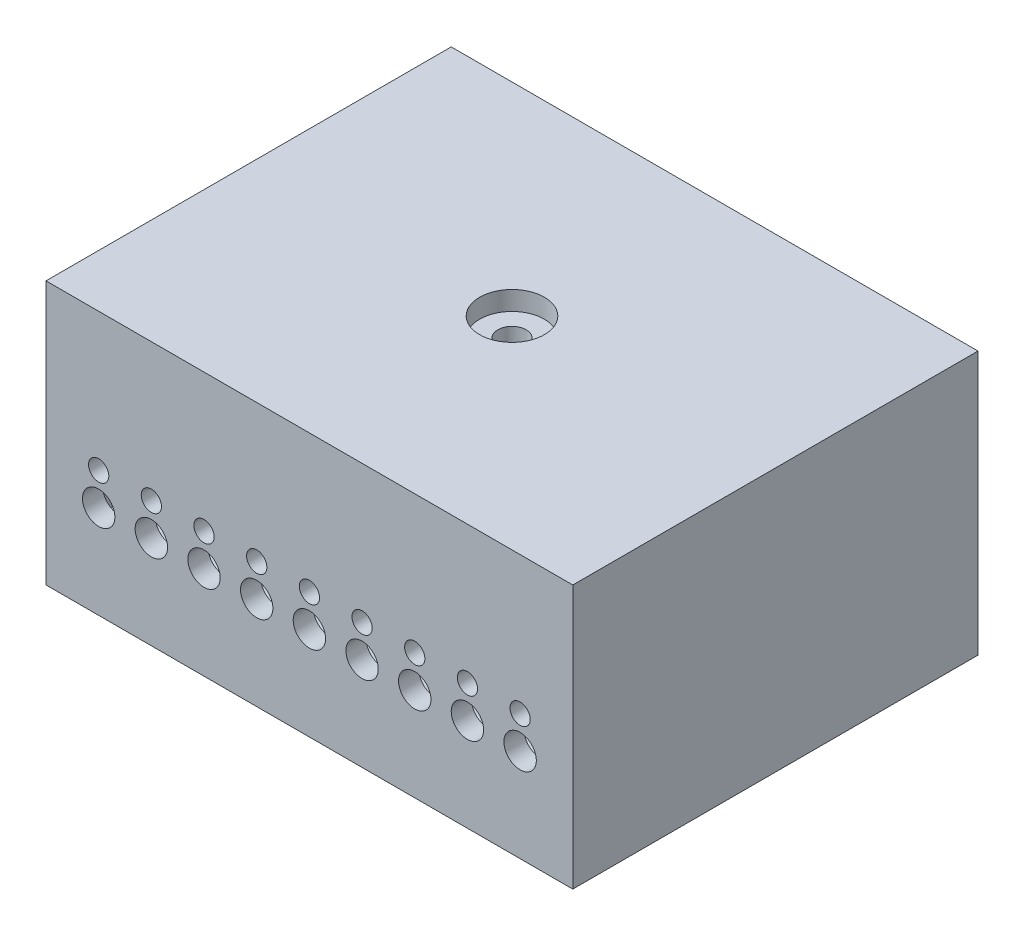
from build123d import *

# Parameters (mm, degrees)
SKETCH1_W                                        = 130
SKETCH1_H                                        = 100
BOSS_EXTRUDE1_DEPTH                              = 65
SKETCH2_W                                        = 110
SKETCH2_H                                        = 80
CUT_EXTRUDE1_DEPTH                               = 10
CBORE_FOR_M6_HEX_HEAD_MACHINE_SCREW1_D           = 7
CBORE_FOR_M6_HEX_HEAD_MACHINE_SCREW1_CBORE_D     = 16
CBORE_FOR_M6_HEX_HEAD_MACHINE_SCREW1_CBORE_DEPTH = 4.7
SHELL1_START                                     = 15
SHELL1_OUTLINE_W                                 = 120
SHELL1_OUTLINE_H                                 = 95
SHELL1_OUTLINE_R                                 = 13
SHELL1_DEPTH                                     = 45
SHELL1_2_OUTLINE_R                               = 13
SHELL1_2_OUTLINE_R_2                             = 8.5
SHELL1_2_DEPTH                                   = 40.3
SHELL1_START_2                                   = -60
SHELL1_3_DEPTH                                   = 120
SHELL1_START_3                                   = -46
SHELL1_4_DEPTH                                   = 91
SKETCH6_R                                        = 4
SKETCH6_R_2                                      = 2.5
CUT_EXTRUDE2_DEPTH                               = 133.193040664


with BuildPart() as part:
    # Sketch1 → Boss-Extrude1 (new body)
    with BuildSketch(Plane(origin=(0, 0, 0), x_dir=(1, 0, 0), z_dir=(0, 1, 0))):
        Rectangle(SKETCH1_W, SKETCH1_H)
    extrude(amount=BOSS_EXTRUDE1_DEPTH)

    # Sketch2 → Cut-Extrude1 (cut)
    with BuildSketch(Plane.XZ):
        Rectangle(SKETCH2_W, SKETCH2_H)
    extrude(amount=-CUT_EXTRUDE1_DEPTH, mode=Mode.SUBTRACT)

    # Draft1: read off the stored shape, not the designer's step
    # Draft1: loft between two sections, ruled curve by curve
    draft1_from = [
        Edge.make_line((55, 10, -40), (-55, 10, -40)),
        Edge.make_line((-55, 10, -40), (-55, 10, 40)),
        Edge.make_line((-55, 10, 40), (55, 10, 40)),
        Edge.make_line((55, 10, 40), (55, 10, -40)),
    ]
    draft1_to = [
        Edge.make_line((58.639702343, 0, -43.639702343), (-58.639702343, 0, -43.639702343)),
        Edge.make_line((-58.639702343, 0, -43.639702343), (-58.639702343, 0, 43.639702343)),
        Edge.make_line((-58.639702343, 0, 43.639702343), (58.639702343, 0, 43.639702343)),
        Edge.make_line((58.639702343, 0, 43.639702343), (58.639702343, 0, -43.639702343)),
    ]
    draft1 = Solid(Shell([*[Face.make_surface_from_curves(draft1_from[k], draft1_to[k]) for k in range(4)], Face(Wire(draft1_from)), Face(Wire(draft1_to))]))
    add(draft1, mode=Mode.SUBTRACT)

    # CBORE for M6 Hex Head Machine Screw1 (through all)
    with Locations(Plane(origin=(0, 65, 0), x_dir=(1, 0, 0), z_dir=(0, 1, 0))):
        with Locations((0, 0)):
            CounterBoreHole(CBORE_FOR_M6_HEX_HEAD_MACHINE_SCREW1_D / 2, CBORE_FOR_M6_HEX_HEAD_MACHINE_SCREW1_CBORE_D / 2, CBORE_FOR_M6_HEX_HEAD_MACHINE_SCREW1_CBORE_DEPTH)

    # Shell1: read off the stored shape, not the designer's step
    # Shell1 outline → Shell1 (cut)
    with BuildSketch(Plane(origin=(0, 0, 0), x_dir=(1, 0, 0), z_dir=(0, 1, 0)).offset(SHELL1_START)):
        with Locations((0, 2.5)):
            Rectangle(SHELL1_OUTLINE_W, SHELL1_OUTLINE_H)
        Circle(SHELL1_OUTLINE_R, mode=Mode.SUBTRACT)
    extrude(amount=SHELL1_DEPTH, mode=Mode.SUBTRACT)

    # Shell1 2 outline → Shell1 2 (cut)
    with BuildSketch(Plane(origin=(0, 0, 0), x_dir=(1, 0, 0), z_dir=(0, 1, 0)).offset(SHELL1_START)):
        Circle(SHELL1_2_OUTLINE_R)
        Circle(SHELL1_2_OUTLINE_R_2, mode=Mode.SUBTRACT)
    extrude(amount=SHELL1_2_DEPTH, mode=Mode.SUBTRACT)

    # Shell1 3 outline → Shell1 3 (cut)
    with BuildSketch(Plane.YZ.offset(SHELL1_START_2)):
        Polygon((15, -43.501037691), (5, -47.140740034), (5, -50), (15, -50), align=None)
        Polygon((10.881634904, 45), (15, 43.501037691), (15, 45), align=None)
    extrude(amount=SHELL1_3_DEPTH, mode=Mode.SUBTRACT)

    # Shell1 4 outline → Shell1 4 (cut)
    with BuildSketch(Plane.XY.offset(SHELL1_START_3)):
        Polygon((-60, 15), (-60, 10.881634904), (-58.501037691, 15), align=None)
        Polygon((60, 15), (58.501037691, 15), (60, 10.881634904), align=None)
    extrude(amount=SHELL1_4_DEPTH, mode=Mode.SUBTRACT)

    # Sketch6 → Cut-Extrude2 (cut, through all)
    with BuildSketch(Plane(origin=(0, 0, 45), x_dir=(-1, 0, 0), z_dir=(0, 0, -1))):
        with Locations((-52, 23)):
            Circle(SKETCH6_R)
        with Locations((-52, 31)):
            Circle(SKETCH6_R_2)
        with Locations((-39, 31)):
            Circle(SKETCH6_R_2)
        with Locations((-39, 23)):
            Circle(SKETCH6_R)
        with Locations((-26, 31)):
            Circle(SKETCH6_R_2)
        with Locations((-26, 23)):
            Circle(SKETCH6_R)
        with Locations((-13, 31)):
            Circle(SKETCH6_R_2)
        with Locations((-13, 23)):
            Circle(SKETCH6_R)
        with Locations((0, 31)):
            Circle(SKETCH6_R_2)
        with Locations((0, 23)):
            Circle(SKETCH6_R)
        with Locations((13, 31)):
            Circle(SKETCH6_R_2)
        with Locations((13, 23)):
            Circle(SKETCH6_R)
        with Locations((26, 31)):
            Circle(SKETCH6_R_2)
        with Locations((26, 23)):
            Circle(SKETCH6_R)
        with Locations((39, 31)):
            Circle(SKETCH6_R_2)
        with Locations((39, 23)):
            Circle(SKETCH6_R)
        with Locations((52, 31)):
            Circle(SKETCH6_R_2)
        with Locations((52, 23)):
            Circle(SKETCH6_R)
    extrude(amount=-CUT_EXTRUDE2_DEPTH, mode=Mode.SUBTRACT)


solid = part.part
